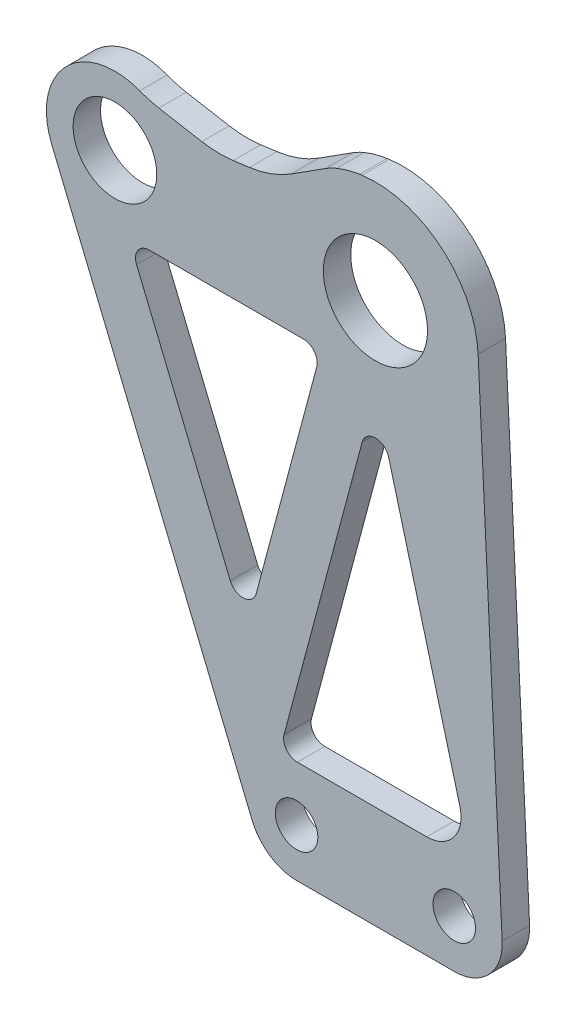
from build123d import *

# Parameters (mm, degrees)
SKETCH_1_R            = 3.1
SKETCH_1_R_2          = 7.6
SKETCH_1_R_3          = 6.1
EXTRUDE_1_DEPTH       = 4
CUT_EXTRUDE_1_DEPTH   = 4
FILLET_1_R            = 2
FILLET_2_R            = 5
CUT_EXTRUDE_START     = -10
CUT_EXTRUDE_2_DEPTH   = 10
CHAMFER_START         = -75.71880289
CHAMFER_2_OUTLINE_W   = 9.932436379
CHAMFER_2_OUTLINE_H   = 4
CHAMFER_2_DEPTH       = 0.082131492
CHAMFER_START_2       = -75.636671398
CHAMFER_2_2_OUTLINE_W = 9.932436379
CHAMFER_2_2_OUTLINE_H = 4
CHAMFER_2_2_DEPTH     = 1.179418361
FILLET_4_R            = 15
FILLET_5_R            = 10


with BuildPart() as part:
    # 草图1 → 凸台-拉伸1 (new body)
    with BuildSketch(Plane.XY):
        with BuildLine():
            Line((-47.242305659, 68.18165139), (-17.969613961, -2.672844027))
            ThreePointArc((-17.969613961, -2.672844027), (-15.391663642, -5.818501018), (-11.5, -7))
            Line((-11.5, -7), (11.5, -7))
            ThreePointArc((11.5, -7), (16.568173397, -4.828417796), (18.491788179, 0.338966167))
            Line((18.491788179, 0.338966167), (14.98240324, 72.726356073))
            ThreePointArc((14.98240324, 72.726356073), (9.608039696, 83.518922397), (-1.973684211, 86.869585423))
            Line((-1.973684211, 86.869585423), (-39.315789474, 81.913056948))
            ThreePointArc((-39.315789474, 81.913056948), (-46.660613019, 76.999378175), (-47.242305659, 68.18165139))
        make_face()
        with Locations((11.5, 0)):
            Circle(SKETCH_1_R, mode=Mode.SUBTRACT)
        with Locations((-11.5, 0)):
            Circle(SKETCH_1_R, mode=Mode.SUBTRACT)
        with Locations((0, 72)):
            Circle(SKETCH_1_R_2, mode=Mode.SUBTRACT)
        with Locations((-38, 72)):
            Circle(SKETCH_1_R_3, mode=Mode.SUBTRACT)
    extrude(amount=EXTRUDE_1_DEPTH)

    # 草图2 → 切除-拉伸1 (cut)
    with BuildSketch(Plane.XY.offset(4)):
        Polygon((0, 60.4), (-14, 8), (14, 8), align=None)
        Polygon((-35.991267369, 61.9), (-7.879846422, 61.9), (-18.919878801, 20.578735952), align=None)
    extrude(amount=-CUT_EXTRUDE_1_DEPTH, mode=Mode.SUBTRACT)

    # 圆角1
    fillet_1_edges = [part.edges().sort_by_distance(p)[0] for p in [
        (-18.919878801, 20.578735952, 2),
        (-35.991267369, 61.9, 2),
        (-7.879846422, 61.9, 2),
        (0, 60.4, 2),
        (-14, 8, 2),
    ]]
    fillet(fillet_1_edges, radius=FILLET_1_R)

    # 圆角2
    fillet_2_edges = [part.edges().sort_by_distance(p)[0] for p in [
        (14, 8, 2),
    ]]
    fillet(fillet_2_edges, radius=FILLET_2_R)

    # 草图3 → 切除-拉伸2 (cut)
    with BuildSketch(Plane.XY.offset(4).offset(CUT_EXTRUDE_START)):
        with BuildLine():
            Line((-30.07293559, 78.096035584), (-12.403974557, 80.441289229))
            ThreePointArc((-12.403974557, 80.441289229), (-8.018810771, 84.681191682), (-2.308312161, 86.825169261))
            Line((-2.308312161, 86.825169261), (-39.315789474, 81.913056948))
            ThreePointArc((-39.315789474, 81.913056948), (-34.182978636, 81.242853883), (-30.07293559, 78.096035584))
        make_face()
    extrude(amount=CUT_EXTRUDE_2_DEPTH, mode=Mode.SUBTRACT)

    # 倒角1
    # the kernel refuses this chamfer: 10 mm, written as the material it adds along each edge
    with BuildSketch(Plane(origin=(-30.07293559, 78.096035584, 0), x_dir=(0.9913056948335455, 0.13157894736842105, 0), z_dir=(0, 0, 1))) as chamfer_1_piece_1:
        with BuildLine():
            Line((7.475531418, -0.121000067), (-3.274957131, 3.290873048))
            Line((-3.274957131, 3.290873048), (-3.390288264, 3.127475588))
            ThreePointArc((-3.390288264, 3.127475588), (-1.542012582, 1.735773049), (-0.173205081, -0.1))
            Line((-0.173205081, -0.1), (0, -0.2))
            ThreePointArc((0, -0.2), (3.737765709, -0.2), (7.475531418, -0.321000067))
            Line((7.475531418, -0.321000067), (7.475531418, -0.121000067))
        make_face()
    extrude(amount=4)

    # 倒角2: read off the stored shape, not the designer's step
    # 倒角2 outline → 倒角2 (cut)
    with BuildSketch(Plane(origin=(0, 0, 0), x_dir=(0.8432639594677482, 0.5374996694536432, 0), z_dir=(0.5374996694536432, -0.8432639594677483, 0)).offset(CHAMFER_START)):
        with Locations((35.301502575, 2)):
            Rectangle(CHAMFER_2_OUTLINE_W, CHAMFER_2_OUTLINE_H)
    extrude(amount=CHAMFER_2_DEPTH, mode=Mode.SUBTRACT)

    # Chamfer 2 2 outline → Chamfer 2 2 (add)
    with BuildSketch(Plane(origin=(0, 0, 0), x_dir=(0.8432639594677482, 0.5374996694536432, 0), z_dir=(0.5374996694536432, -0.8432639594677483, 0)).offset(CHAMFER_START_2)):
        with Locations((35.301502575, 2)):
            Rectangle(CHAMFER_2_2_OUTLINE_W, CHAMFER_2_2_OUTLINE_H)
    extrude(amount=CHAMFER_2_2_DEPTH)

    # 圆角4
    fillet_4_edges = [part.edges().sort_by_distance(p)[0] for p in [
        (-23.040343668, 79.029492385, 2),
        (-33.358562851, 80.857599065, 2),
        (-15.074033853, 80.086884334, 2),
    ]]
    fillet(fillet_4_edges, radius=FILLET_4_R)

    # 圆角5
    fillet_5_edges = [part.edges().sort_by_distance(p)[0] for p in [
        (-6.698368225, 85.425565604, 2),
    ]]
    fillet(fillet_5_edges, radius=FILLET_5_R)


solid = part.part
